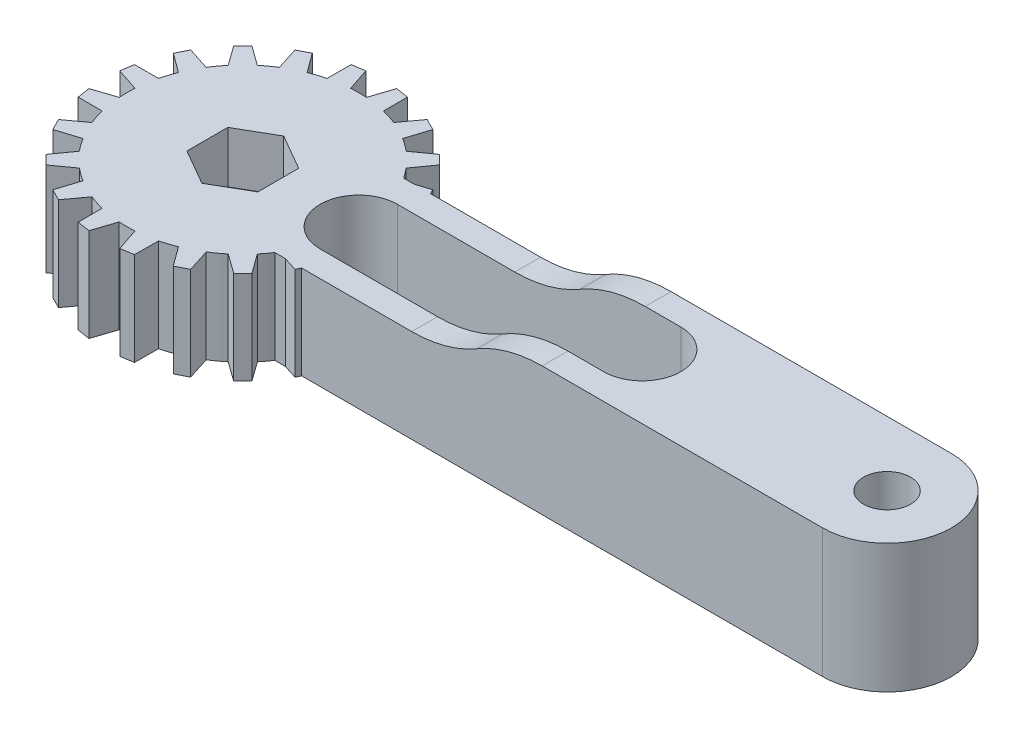
from build123d import *

# Parameters (mm, degrees)
SKIZZE1_R                       = 1.825
AUFSATZ_LINEAR_AUSTRAGEN1_DEPTH = 10
SCHNITT_LINEAR_AUSTRAGEN1_DEPTH = 2.75
VERRUNDUNG1_R                   = 10
VERRUNDUNG2_R                   = 10
SKIZZE2_R                       = 9
SKIZZE2_R_2                     = 5
AUFSATZ_LINEAR_AUSTRAGEN2_DEPTH = 7.25
AUFSATZ_LINEAR_AUSTRAGEN3_DEPTH = 7.25
KREISMUSTER1_COUNT              = 20
SCHNITT_LINEAR_AUSTRAGEN3_DEPTH = 4
SCHNITT_LINEAR_AUSTRAGEN4_DEPTH = 57.925042167


with BuildPart() as part:
    # Skizze1 → Aufsatz-Linear austragen1 (new body)
    with BuildSketch(Plane(origin=(0, 0, 0), x_dir=(1, 0, 0), z_dir=(0, 1, 0))):
        with BuildLine():
            Line((0, 5), (50, 5))
            ThreePointArc((50, 5), (55, 0), (50, -5))
            Line((50, -5), (0, -5))
            ThreePointArc((0, -5), (-5, 0), (0, 5))
        make_face()
        with Locations(Location((50, 0, 0), (0, 0, 270))):
            Circle(SKIZZE1_R, mode=Mode.SUBTRACT)
        with Locations(Location((0, 0, 0), (0, 0, 270))):
            Circle(SKIZZE1_R, mode=Mode.SUBTRACT)
    extrude(amount=-AUFSATZ_LINEAR_AUSTRAGEN1_DEPTH)

    # Skizze5 → Schnitt-Linear austragen1 (cut)
    with BuildSketch(Plane(origin=(0, 0, 0), x_dir=(1, 0, 0), z_dir=(0, 1, 0))):
        with BuildLine():
            Line((0, -5), (25, -5))
            Line((25, -5), (25, 5))
            Line((25, 5), (0, 5))
            ThreePointArc((0, 5), (-5, 0), (0, -5))
        make_face()
    extrude(amount=-SCHNITT_LINEAR_AUSTRAGEN1_DEPTH, mode=Mode.SUBTRACT)

    # Verrundung1
    # the kernel refuses this fillet: 10 mm, written as the material it adds along each edge
    with BuildSketch(Plane(origin=(25, -2.75, 5), x_dir=(-1, 0, 0), z_dir=(0, 0, -1))) as verrundung1_piece_1:
        with BuildLine():
            CenterArc((6.887488657, 10), VERRUNDUNG1_R, 226.468847833, 43.531152167)
            Line((0, 2.75), (-0.137749773, 2.605))
            ThreePointArc((-0.137749773, 2.605), (-0.2, 1.375), (-0.2, 0))
            Line((-0.2, 0), (0, -0.2))
            Line((0, -0.2), (6.887488657, -0.2))
            Line((6.887488657, -0.2), (6.887488657, 0))
        make_face()
    extrude(amount=10)

    # Verrundung2
    verrundung2_edges = [part.edges().sort_by_distance(p)[0] for p in [
        (25, 0, 0),
    ]]
    fillet(verrundung2_edges, radius=VERRUNDUNG2_R)

    # Skizze2 → Aufsatz-Linear austragen2 (add)
    with BuildSketch(Plane(origin=(0, -2.75, 0), x_dir=(1, 0, 0), z_dir=(0, 1, 0))):
        Circle(SKIZZE2_R)
        Circle(SKIZZE2_R_2, mode=Mode.SUBTRACT)
    extrude(amount=-AUFSATZ_LINEAR_AUSTRAGEN2_DEPTH)

    # Skizze3 → Aufsatz-Linear austragen3 (add)
    with BuildSketch(Plane(origin=(0, -2.75, 0), x_dir=(1, 0, 0), z_dir=(0, 1, 0))):
        with BuildLine():
            Line((-8.979155186, 0.612186368), (-10.745251311, 1.195648052))
            Line((-10.745251311, 1.195648052), (-10.588816846, 2.183336393))
            Line((-10.588816846, 2.183336393), (-8.728860042, 2.192487713))
            ThreePointArc((-8.728860042, 2.192487713), (-8.889195065, 1.407910185), (-8.979155186, 0.612186368))
        make_face()
    aufsatz_linear_austragen3 = extrude(amount=-AUFSATZ_LINEAR_AUSTRAGEN3_DEPTH)

    # Kreismuster1: Aufsatz-Linear austragen3 ×20 about axis
    kreismuster1_axis = Axis((0, 0, 0), (0, 1, 0))
    for i in range(1, KREISMUSTER1_COUNT):
        add(aufsatz_linear_austragen3.rotate(kreismuster1_axis, i * 360 / KREISMUSTER1_COUNT))

    # Skizze8 → Schnitt-Linear austragen3 (cut)
    with BuildSketch(Plane(origin=(0, -2.75, 0), x_dir=(1, 0, 0), z_dir=(0, 1, 0))):
        Polygon((0, 3.175426481), (-2.75, 1.58771324), (-2.75, -1.58771324), (0, -3.175426481), (2.75, -1.58771324), (2.75, 1.58771324), align=None)
    extrude(amount=-SCHNITT_LINEAR_AUSTRAGEN3_DEPTH, mode=Mode.SUBTRACT)

    # Skizze10 → Schnitt-Linear austragen4 (cut, through all)
    with BuildSketch(Plane.XZ.offset(10)):
        with BuildLine():
            Line((9, 3), (31, 3))
            ThreePointArc((31, 3), (34, 0), (31, -3))
            Line((31, -3), (9, -3))
            ThreePointArc((9, -3), (6, 0), (9, 3))
        make_face()
    extrude(amount=-SCHNITT_LINEAR_AUSTRAGEN4_DEPTH, mode=Mode.SUBTRACT)


solid = part.part
